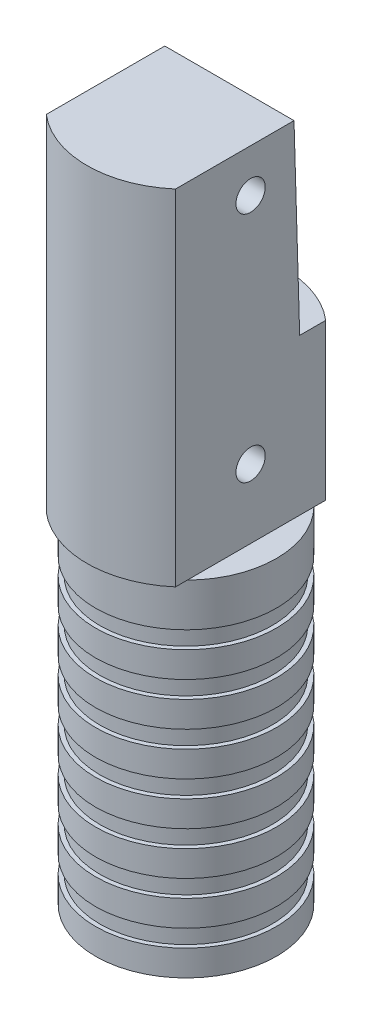
from build123d import *

# Parameters (mm, degrees)
SKETCH3_W                      = 0.5
SKETCH3_H                      = 2
LPATTERN1_COUNT                = 7
LPATTERN1_PITCH                = 5
BOSS_EXTRUDE1_DEPTH            = 40
F_15_0_15_DIAMETER_HOLE1_D     = 15
F_15_0_15_DIAMETER_HOLE1_DEPTH = 30
F_15_0_15_DIAMETER_HOLE1_TIP   = 4.506454643
M3_CLEARANCE_HOLE1_D           = 3.4
CUT_EXTRUDE1_DEPTH             = 43.924352063
CUT_EXTRUDE1_DEPTH_BACK        = 43.924352063
SKETCH16_R                     = 1.7


with BuildPart() as part:
    # Sketch2 → Revolve1 (revolve)
    with BuildSketch(Plane.XY):
        Polygon((0, 0), (-10.5, 0), (-10.5, -40), (-1, -40), (0, -40), align=None)
    revolve(axis=Axis((0, 0, 0), (0, -1, 0)))

    # Sketch3 → Cut-Revolve1 (revolve, cut)
    with BuildSketch(Plane.XY):
        with Locations((10.25, -36)):
            Rectangle(SKETCH3_W, SKETCH3_H)
    cut_revolve1 = revolve(axis=Axis((0, 0, 0), (0, -1, 0)), mode=Mode.SUBTRACT)

    # LPattern1: Cut-Revolve1 ×7
    with Locations(*[(0, i * LPATTERN1_PITCH, 0) for i in range(1, LPATTERN1_COUNT)]):
        add(cut_revolve1, mode=Mode.SUBTRACT)

    # Sketch6 → Boss-Extrude1 (add)
    with BuildSketch(Plane(origin=(0, 0, 0), x_dir=(1, 0, 0), z_dir=(0, 1, 0))):
        with BuildLine():
            Line((-7.5, 8.717797887), (-7.5, -8.717797887))
            ThreePointArc((-7.5, -8.717797887), (0, -11.5), (7.5, -8.717797887))
            Line((7.5, -8.717797887), (7.5, 8.717797887))
            ThreePointArc((7.5, 8.717797887), (0, 11.5), (-7.5, 8.717797887))
        make_face()
    extrude(amount=BOSS_EXTRUDE1_DEPTH)

    # Ø15.0 (15) Diameter Hole1
    with Locations(Plane.XZ.offset(40)):
        with Locations((0, 0)):
            Hole(F_15_0_15_DIAMETER_HOLE1_D / 2, depth=F_15_0_15_DIAMETER_HOLE1_DEPTH)
            with Locations((0, 0, -(F_15_0_15_DIAMETER_HOLE1_DEPTH + F_15_0_15_DIAMETER_HOLE1_TIP / 2))):  # 118° drill point
                Cone(0, F_15_0_15_DIAMETER_HOLE1_D / 2, F_15_0_15_DIAMETER_HOLE1_TIP, mode=Mode.SUBTRACT)

    # M3 Clearance Hole1 (through all)
    with Locations(Plane(origin=(7.5, 0, 0), x_dir=(0, 0, -1), z_dir=(1, 0, 0))):
        with Locations((0, 8), (0, 35)):
            Hole(M3_CLEARANCE_HOLE1_D / 2)

    # Sketch16 → Cut-Extrude1 (cut, two sides: drawn at the far end of the back side and taken through both)
    with BuildSketch(Plane(origin=(0, 0, 0), x_dir=(0, 0, -1), z_dir=(1, 0, 0)).offset(-CUT_EXTRUDE1_DEPTH_BACK)):
        with Locations((0, 8)):
            Circle(SKETCH16_R)
        with Locations((0, 35)):
            Circle(SKETCH16_R)
        Polygon((5.037728025, 40), (5.6954411, 18.081644681), (11.5, 18.081644681), (11.5, 40), (8.717797887, 40), align=None)
    extrude(amount=CUT_EXTRUDE1_DEPTH + CUT_EXTRUDE1_DEPTH_BACK, mode=Mode.SUBTRACT)


solid = part.part
